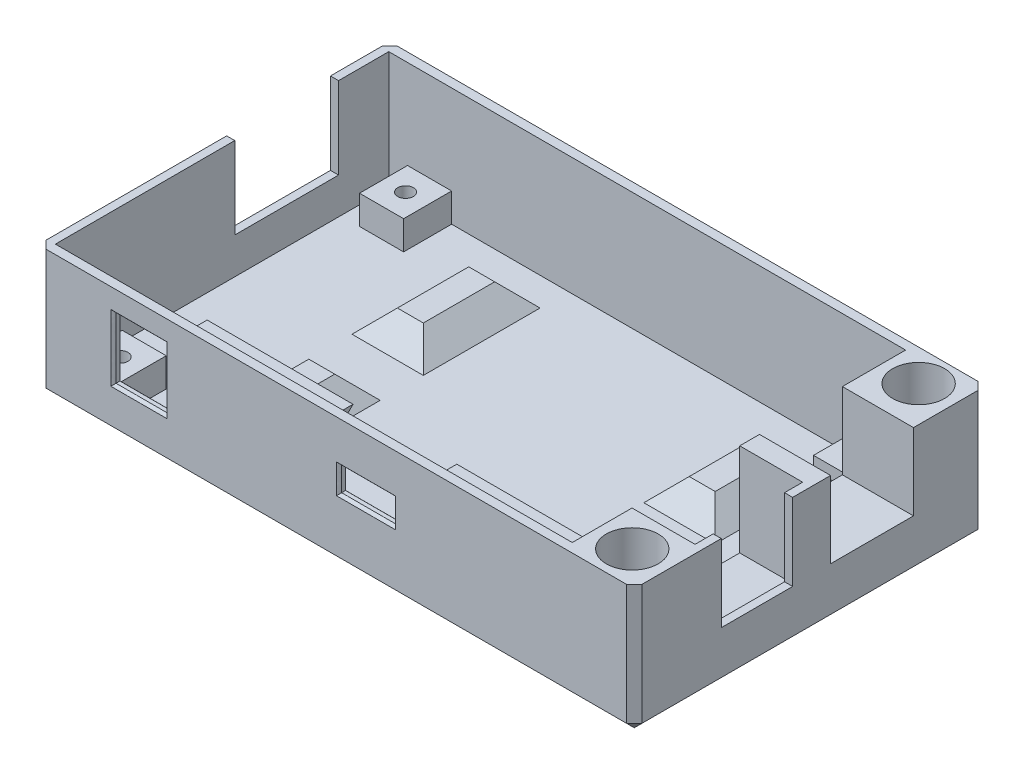
from build123d import *

# Parameters (mm, degrees)
SKETCH1_W                                  = 116.713
SKETCH1_H                                  = 68.834
BOSS_EXTRUDE1_DEPTH                        = 25.0952
SKETCH2_W                                  = 101.2063
SKETCH2_H                                  = 65.278
HOLLOW_DEPTH                               = 23.110825
F_5V_HOLE_REACH                            = 126.523
SKETCH3_W                                  = 10.016
SKETCH3_H                                  = 12.016
USB_HOLE_REACH                             = 125.549
SKETCH4_W                                  = 10.54
SKETCH4_H                                  = 4.72
SKETCH11_W                                 = 8.636
SKETCH11_H                                 = 9.398
PCB_MOUNT_BOSS_DEPTH                       = 7.62
SKETCH8_R                                  = 5.08
HOLE_TO_ACCEPT_TOP_DEPTH                   = 18.7452
SKETCH9_R                                  = 1.5875
SKETCH9_R_2                                = 1.524
HOLE_SCREWS_DEPTH                          = 125.379362571
SKETCH12_R                                 = 1.524
SCREW_FASTENER_HOLES_DEPTH                 = 6.604
SKETCH10_R                                 = 2.8194
PAN_HEAD_COUNTER_SINK_DEPTH                = 2.286
SKETCH13_W                                 = 6.35
SKETCH13_H                                 = 3.175
NUT_SLOT_1_DEPTH                           = 7.62
NUT_START                                  = 46.482
SKETCH13_3_W                               = 6.35
SKETCH13_3_H                               = 3.175
NUT_SLOT_2_DEPTH                           = 7.62
HEX_OUT_NUT_SLOT_DEPTH                     = 3.175
SKETCH24_W                                 = 12.3317
SKETCH24_H                                 = 21.082
F_4_PIN_1_DEPTH                            = 18.161
F_4_PIN_2_REACH                            = 137.297
SKETCH25_W                                 = 13.97
SKETCH25_H                                 = 11.176
CUT_EXTRUDE6_REACH                         = 137.297
SKETCH26_W                                 = 13.97
SKETCH26_H                                 = 3.937
SKETCH5_W                                  = 16.2306
SKETCH5_H                                  = 16.2306
F_9_PIN_IN_DEPTH                           = 124.490970611
SKETCH23_W                                 = 20.32
SKETCH23_H                                 = 18.415
F_9_PIN_OUT_DEPTH                          = 1.5875
FILLET2_START                              = 4.1020999
FILLET2_DEPTH                              = 5.7360002
FILLET2_START_2                            = 0.5714999
FILLET2_2_DEPTH                            = 13.0320002
FILLET2_START_3                            = -77.0339999
FILLET2_3_DEPTH                            = 46.0339999
FILLET2_START_4                            = -89
FILLET2_4_DEPTH                            = 45.1127999
KEY_HOLE_1_DEPTH                           = 124.994221651
SKETCH17_W                                 = 13.97
SKETCH17_H                                 = 22.86
COVER_MOUNTING_SCREW_HEADS_DEPTH           = 4.445
COVER_MOUNTING_SCREW_HEADS_DRAFT           = 45
COVER_MOUNTING_SCREW_HEADS_PROFILE_2_DEPTH = 4.445
COVER_MOUNTING_SCREW_HEADS_PROFILE_2_DRAFT = 45
SKETCH18_W                                 = 10.795
SKETCH18_H                                 = 19.685
HOLLOW_FOR_SCREWS_DEPTH                    = 3.556
HOLLOW_FOR_SCREWS_DRAFT                    = 45
HOLLOW_FOR_SCREWS_PROFILE_2_DEPTH          = 3.556
HOLLOW_FOR_SCREWS_PROFILE_2_DRAFT          = 45
KEYHOLE_MIRROR_COPY_1_SKETCH_W             = 13.97
KEYHOLE_MIRROR_COPY_1_SKETCH_H             = 22.86
KEYHOLE_MIRROR_COPY_1_DEPTH                = 4.445
KEYHOLE_MIRROR_COPY_1_DRAFT                = 45
KEYHOLE_MIRROR_COPY_2_SKETCH_W             = 13.97
KEYHOLE_MIRROR_COPY_2_SKETCH_H             = 22.86
KEYHOLE_MIRROR_COPY_2_DEPTH                = 4.445
KEYHOLE_MIRROR_COPY_2_DRAFT                = 45
KEYHOLE_MIRROR_COPY_3_SKETCH_W             = 13.97
KEYHOLE_MIRROR_COPY_3_SKETCH_H             = 22.86
KEYHOLE_MIRROR_COPY_3_DEPTH                = 4.445
KEYHOLE_MIRROR_COPY_3_DRAFT                = 45
KEYHOLE_MIRROR_COPY_4_SKETCH_W             = 10.795
KEYHOLE_MIRROR_COPY_4_SKETCH_H             = 19.685
KEYHOLE_MIRROR_COPY_4_DEPTH                = 3.556
KEYHOLE_MIRROR_COPY_4_DRAFT                = 45
KEYHOLE_MIRROR_COPY_5_SKETCH_W             = 10.795
KEYHOLE_MIRROR_COPY_5_SKETCH_H             = 19.685
KEYHOLE_MIRROR_COPY_5_DEPTH                = 3.556
KEYHOLE_MIRROR_COPY_5_DRAFT                = 45
KEYHOLE_MIRROR_COPY_6_SKETCH_W             = 10.795
KEYHOLE_MIRROR_COPY_6_SKETCH_H             = 19.685
KEYHOLE_MIRROR_COPY_6_DEPTH                = 3.556
KEYHOLE_MIRROR_COPY_6_DRAFT                = 45
CHAMFER1_SIZE                              = 1.524
LCD_BACKSTOP_1_DEPTH                       = 27.1272
LCD_START                                  = 47.4472
LCD_BACKSTOP_2_DEPTH                       = 28.5708
SKETCH29_R                                 = 0.9921875
ANTENNA_DEPTH                              = 123.853065822


with BuildPart() as part:
    # Sketch1 → Boss-Extrude1 (new body)
    with BuildSketch(Plane(origin=(0, -7.62, 0), x_dir=(1, 0, 0), z_dir=(0, 1, 0))):
        with Locations((-43.9293, 31.75)):
            Rectangle(SKETCH1_W, SKETCH1_H)
    extrude(amount=BOSS_EXTRUDE1_DEPTH)

    # Sketch2 → hollow (cut)
    with BuildSketch(Plane(origin=(0, 17.4752, 0), x_dir=(1, 0, 0), z_dir=(0, 1, 0))):
        with Locations((-50.09515, 31.75)):
            Rectangle(SKETCH2_W, SKETCH2_H)
    extrude(amount=-HOLLOW_DEPTH, mode=Mode.SUBTRACT)

    # Sketch3 → 5v hole (cut, up to next)
    with BuildSketch(Plane.XY.offset(2.667), mode=Mode.PRIVATE) as f_5v_hole_sk1:
        with Locations((-82.55, 7.0875)):
            Rectangle(SKETCH3_W, SKETCH3_H)
    f_5v_hole_tool1 = extrude(f_5v_hole_sk1.sketch, amount=-F_5V_HOLE_REACH, mode=Mode.PRIVATE) & part.part
    add(f_5v_hole_tool1.solids().sort_by_distance((-82.55, 7.0875, 2.667))[0], mode=Mode.SUBTRACT)

    # Sketch4 → USB hole (cut, up to next)
    with BuildSketch(Plane(origin=(0, 0, 0.889), x_dir=(-1, 0, 0), z_dir=(0, 0, -1)), mode=Mode.PRIVATE) as usb_hole_sk1:
        with Locations((38.1092, 6.9701)):
            Rectangle(SKETCH4_W, SKETCH4_H)
    usb_hole_tool1 = extrude(usb_hole_sk1.sketch, amount=-USB_HOLE_REACH, mode=Mode.PRIVATE) & part.part
    add(usb_hole_tool1.solids().sort_by_distance((-38.1092, 6.9701, 0.889))[0], mode=Mode.SUBTRACT)

    # Sketch11 → PCB mount boss (add)
    with BuildSketch(Plane(origin=(0, -7.62, 0), x_dir=(1, 0, 0), z_dir=(0, 1, 0))):
        with Locations((-92.71, 3.81)):
            Rectangle(SKETCH11_W, SKETCH11_H)
        with Locations((-92.71, 59.69)):
            Rectangle(SKETCH11_W, SKETCH11_H)
        with Locations((-3.81, 59.69)):
            Rectangle(SKETCH11_W, SKETCH11_H)
        with Locations((-3.81, 3.81)):
            Rectangle(SKETCH11_W, SKETCH11_H)
    extrude(amount=PCB_MOUNT_BOSS_DEPTH)

    # Sketch8 → hole to accept top (cut)
    with BuildSketch(Plane(origin=(0, 17.4752, 0), x_dir=(1, 0, 0), z_dir=(0, 1, 0))):
        with Locations(Location((7.4676, 3.8989, 0), (0, 0, 270))):
            Circle(SKETCH8_R)
        with Locations(Location((7.4676, 59.9821, 0), (0, 0, 270))):
            Circle(SKETCH8_R)
    extrude(amount=-HOLE_TO_ACCEPT_TOP_DEPTH, mode=Mode.SUBTRACT)

    # Sketch9 → hole screws (cut, through all)
    with BuildSketch(Plane.XZ.offset(7.62)):
        with Locations(Location((7.4676, -59.9821, 0), (0, 0, 270))):
            Circle(SKETCH9_R)
        with Locations(Location((7.4676, -3.8989, 0), (0, 0, 270))):
            Circle(SKETCH9_R)
        with Locations(Location((-92.71, -59.69, 0), (0, 0, 270))):
            Circle(SKETCH9_R_2)
        with Locations(Location((-92.71, -3.81, 0), (0, 0, 270))):
            Circle(SKETCH9_R_2)
    extrude(amount=-HOLE_SCREWS_DEPTH, mode=Mode.SUBTRACT)

    # Sketch12 → screw fastener holes (cut)
    with BuildSketch(Plane(origin=(0, 0, 0), x_dir=(1, 0, 0), z_dir=(0, 1, 0))):
        with Locations(Location((-3.81, 3.81, 0), (0, 0, 270))):
            Circle(SKETCH12_R)
        with Locations(Location((-3.81, 59.69, 0), (0, 0, 270))):
            Circle(SKETCH12_R)
    extrude(amount=-SCREW_FASTENER_HOLES_DEPTH, mode=Mode.SUBTRACT)

    # Sketch10 → pan head counter sink (cut)
    with BuildSketch(Plane.XZ.offset(7.62)):
        with Locations(Location((7.4676, -59.9821, 0), (0, 0, 270))):
            Circle(SKETCH10_R)
        with Locations(Location((-92.71, -59.69, 0), (0, 0, 270))):
            Circle(SKETCH10_R)
        with Locations(Location((7.4676, -3.8989, 0), (0, 0, 270))):
            Circle(SKETCH10_R)
        with Locations(Location((-92.71, -3.81, 0), (0, 0, 270))):
            Circle(SKETCH10_R)
    extrude(amount=-PAN_HEAD_COUNTER_SINK_DEPTH, mode=Mode.SUBTRACT)

    # Sketch13 → nut slot 1 (cut)
    with BuildSketch(Plane(origin=(0, 0, -8.509), x_dir=(-1, 0, 0), z_dir=(0, 0, -1))):
        with Locations((3.81, -4.048125)):
            Rectangle(SKETCH13_W, SKETCH13_H)
    extrude(amount=-NUT_SLOT_1_DEPTH, mode=Mode.SUBTRACT)

    # Sketch13<3> → nut slot 2 (cut)
    with BuildSketch(Plane(origin=(0, 0, -8.509), x_dir=(-1, 0, 0), z_dir=(0, 0, -1)).offset(NUT_START)):
        with Locations((3.81, -4.048125)):
            Rectangle(SKETCH13_3_W, SKETCH13_3_H)
    extrude(amount=NUT_SLOT_2_DEPTH, mode=Mode.SUBTRACT)

    # Sketch15 → hex out nut slot (cut)
    with BuildSketch(Plane(origin=(0, -5.635625, 0), x_dir=(1, 0, 0), z_dir=(0, 1, 0))):
        Polygon((-3.81, 55.877178822), (-0.508, 57.783589411), (-0.508, 61.596410589), (-3.81, 63.502821178), (-7.112, 61.596410589), (-7.112, 57.783589411), align=None)
        Polygon((-7.112, 1.903589411), (-3.81, -0.002821178), (-0.508, 1.903589411), (-0.508, 5.716410589), (-3.81, 7.622821178), (-7.112, 5.716410589), align=None)
    extrude(amount=HEX_OUT_NUT_SLOT_DEPTH, mode=Mode.SUBTRACT)

    # Sketch24 → 4 pin 1 (cut)
    with BuildSketch(Plane(origin=(0, 17.4752, 0), x_dir=(1, 0, 0), z_dir=(0, 1, 0))):
        with Locations((6.67385, 21.3614)):
            Rectangle(SKETCH24_W, SKETCH24_H)
    extrude(amount=-F_4_PIN_1_DEPTH, mode=Mode.SUBTRACT)

    # Sketch25 → 4 pin 2 (cut, up to next)
    with BuildSketch(Plane(origin=(14.4272, 0, 0), x_dir=(0, 0, -1), z_dir=(1, 0, 0)), mode=Mode.PRIVATE) as f_4_pin_2_sk1:
        with Locations((21.3614, 7.9502)):
            Rectangle(SKETCH25_W, SKETCH25_H)
    f_4_pin_2_tool1 = extrude(f_4_pin_2_sk1.sketch, amount=-F_4_PIN_2_REACH, mode=Mode.PRIVATE) & part.part
    add(f_4_pin_2_tool1.solids().sort_by_distance((14.4272, 7.9502, -21.3614))[0], mode=Mode.SUBTRACT)

    # Sketch26 → Cut-Extrude6 (cut, up to next)
    with BuildSketch(Plane(origin=(14.4272, 0, 0), x_dir=(0, 0, -1), z_dir=(1, 0, 0)), mode=Mode.PRIVATE) as cut_extrude6_sk1:
        with Locations((21.3614, 15.5067)):
            Rectangle(SKETCH26_W, SKETCH26_H)
    cut_extrude6_tool1 = extrude(cut_extrude6_sk1.sketch, amount=-CUT_EXTRUDE6_REACH, mode=Mode.PRIVATE) & part.part
    add(cut_extrude6_tool1.solids().sort_by_distance((14.4272, 15.5067, -21.3614))[0], mode=Mode.SUBTRACT)

    # Sketch5 → 9 pin in (cut, through all)
    with BuildSketch(Plane.ZY.offset(-0.508)):
        with Locations((-43.8912, 10.6172)):
            Rectangle(SKETCH5_W, SKETCH5_H)
    extrude(amount=-F_9_PIN_IN_DEPTH, mode=Mode.SUBTRACT)

    # Sketch23 → 9 pin out (cut)
    with BuildSketch(Plane.ZY.offset(102.2858)):
        with Locations((-44.3992, 10.668)):
            Rectangle(SKETCH23_W, SKETCH23_H)
    extrude(amount=-F_9_PIN_OUT_DEPTH, mode=Mode.SUBTRACT)

    # Fillet2: read off the stored shape, not the designer's step
    # Fillet2 outline → Fillet2 (cut)
    with BuildSketch(Plane(origin=(0, 0, 0), x_dir=(1, 0, 0), z_dir=(0, 1, 0)).offset(FILLET2_START)):
        with BuildLine():
            Line((-32.8392, -0.889), (-32.8392, -1.397))
            add(Edge.make_bspline(
                [(-32.8392, -1.397), (-32.8392, -0.889), (-32.3312, -0.889)],
                knots=[0, 0, 0, 1, 1, 1], degree=2, weights=[1, 0.035921024, 1]))
            Line((-32.3312, -0.889), (-32.8392, -0.889))
        make_face()
        Polygon((-32.8392, -2.159), (-32.8392, -1.397), (-32.8392, -0.889), (-43.3792, -0.889), (-43.3792, -1.397), (-43.3792, -2.159), (-43.3792, -2.667), (-32.8392, -2.667), align=None)
        with BuildLine():
            add(Edge.make_bspline(
                [(-32.8392, -2.159), (-32.8392, -2.667), (-32.3312, -2.667)],
                knots=[0, 0, 0, 1, 1, 1], degree=2, weights=[1, 0.035921024, 1]))
            Line((-32.8392, -2.159), (-32.8392, -2.667))
            Line((-32.8392, -2.667), (-32.3312, -2.667))
        make_face()
        with BuildLine():
            Line((-43.3792, -1.397), (-43.3792, -0.889))
            Line((-43.3792, -0.889), (-43.8872, -0.889))
            add(Edge.make_bspline(
                [(-43.3792, -1.397), (-43.3792, -0.889), (-43.8872, -0.889)],
                knots=[0, 0, 0, 1, 1, 1], degree=2, weights=[1, 0.035921024, 1]))
        make_face()
        with BuildLine():
            Line((-43.8872, -2.667), (-43.3792, -2.667))
            Line((-43.3792, -2.667), (-43.3792, -2.159))
            add(Edge.make_bspline(
                [(-43.3792, -2.159), (-43.3792, -2.667), (-43.8872, -2.667)],
                knots=[0, 0, 0, 1, 1, 1], degree=2, weights=[1, 0.035921024, 1]))
        make_face()
        with BuildLine():
            add(Edge.make_bspline(
                [(-77.542, -1.397), (-77.542, -0.889), (-77.034, -0.889)],
                knots=[0, 0, 0, 1, 1, 1], degree=2, weights=[1, 0.035921024, 1]))
            Line((-77.034, -0.889), (-77.542, -0.889))
            Line((-77.542, -0.889), (-77.542, -1.397))
        make_face()
        with BuildLine():
            Line((-77.542, -2.667), (-77.034, -2.667))
            add(Edge.make_bspline(
                [(-77.542, -2.159), (-77.542, -2.667), (-77.034, -2.667)],
                knots=[0, 0, 0, 1, 1, 1], degree=2, weights=[1, 0.035921024, 1]))
            Line((-77.542, -2.159), (-77.542, -2.667))
        make_face()
        with BuildLine():
            Line((-87.558, -1.397), (-87.558, -0.889))
            Line((-87.558, -0.889), (-88.066, -0.889))
            add(Edge.make_bspline(
                [(-87.558, -1.397), (-87.558, -0.889), (-88.066, -0.889)],
                knots=[0, 0, 0, 1, 1, 1], degree=2, weights=[1, 0.035921024, 1]))
        make_face()
        with BuildLine():
            Line((-88.066, -2.667), (-87.558, -2.667))
            Line((-87.558, -2.667), (-87.558, -2.159))
            add(Edge.make_bspline(
                [(-87.558, -2.159), (-87.558, -2.667), (-88.066, -2.667)],
                knots=[0, 0, 0, 1, 1, 1], degree=2, weights=[1, 0.035921024, 1]))
        make_face()
    extrude(amount=FILLET2_DEPTH, mode=Mode.SUBTRACT)

    # Fillet2 2 outline → Fillet2 2 (cut)
    with BuildSketch(Plane(origin=(0, 0, 0), x_dir=(1, 0, 0), z_dir=(0, 1, 0)).offset(FILLET2_START_2)):
        with BuildLine():
            add(Edge.make_bspline(
                [(-77.542, -1.397), (-77.542, -0.889), (-77.034, -0.889)],
                knots=[0, 0, 0, 1, 1, 1], degree=2, weights=[1, 0.035921024, 1]))
            Line((-77.034, -0.889), (-77.542, -0.889))
            Line((-77.542, -0.889), (-77.542, -1.397))
        make_face()
        with BuildLine():
            Line((-77.542, -2.667), (-77.034, -2.667))
            add(Edge.make_bspline(
                [(-77.542, -2.159), (-77.542, -2.667), (-77.034, -2.667)],
                knots=[0, 0, 0, 1, 1, 1], degree=2, weights=[1, 0.035921024, 1]))
            Line((-77.542, -2.159), (-77.542, -2.667))
        make_face()
        Polygon((-77.542, -2.159), (-77.542, -1.397), (-77.542, -0.889), (-87.558, -0.889), (-87.558, -1.397), (-87.558, -2.159), (-87.558, -2.667), (-77.542, -2.667), align=None)
        with BuildLine():
            Line((-87.558, -1.397), (-87.558, -0.889))
            Line((-87.558, -0.889), (-88.066, -0.889))
            add(Edge.make_bspline(
                [(-87.558, -1.397), (-87.558, -0.889), (-88.066, -0.889)],
                knots=[0, 0, 0, 1, 1, 1], degree=2, weights=[1, 0.035921024, 1]))
        make_face()
        with BuildLine():
            Line((-88.066, -2.667), (-87.558, -2.667))
            Line((-87.558, -2.667), (-87.558, -2.159))
            add(Edge.make_bspline(
                [(-87.558, -2.159), (-87.558, -2.667), (-88.066, -2.667)],
                knots=[0, 0, 0, 1, 1, 1], degree=2, weights=[1, 0.035921024, 1]))
        make_face()
    extrude(amount=FILLET2_2_DEPTH, mode=Mode.SUBTRACT)

    # Fillet2 3 outline → Fillet2 3 (add)
    with BuildSketch(Plane.YZ.offset(FILLET2_START_3)):
        with BuildLine():
            add(Edge.make_bspline(
                [(4.6101, 1.397), (4.6101, 0.889), (4.1021, 0.889)],
                knots=[0, 0, 0, 1, 1, 1], degree=2, weights=[1, 0.035921024, 1]))
            Line((4.6101, 1.397), (4.6101, 2.159))
            add(Edge.make_bspline(
                [(4.6101, 2.159), (4.6101, 2.667), (4.1021, 2.667)],
                knots=[0, 0, 0, 1, 1, 1], degree=2, weights=[1, 0.035921024, 1]))
            Line((4.1021, 2.667), (4.1021, 0.889))
        make_face()
        with BuildLine():
            Line((9.3301, 2.159), (9.3301, 1.397))
            add(Edge.make_bspline(
                [(9.3301, 1.397), (9.3301, 0.889), (9.8381, 0.889)],
                knots=[0, 0, 0, 1, 1, 1], degree=2, weights=[1, 0.035921024, 1]))
            Line((9.8381, 0.889), (9.8381, 2.667))
            add(Edge.make_bspline(
                [(9.3301, 2.159), (9.3301, 2.667), (9.8381, 2.667)],
                knots=[0, 0, 0, 1, 1, 1], degree=2, weights=[1, 0.035921024, 1]))
        make_face()
    extrude(amount=FILLET2_3_DEPTH)

    # Fillet2 4 outline → Fillet2 4 (add)
    with BuildSketch(Plane.YZ.offset(FILLET2_START_4)):
        with BuildLine():
            add(Edge.make_bspline(
                [(1.0795, 1.397), (1.0795, 0.889), (0.5715, 0.889)],
                knots=[0, 0, 0, 1, 1, 1], degree=2, weights=[1, 0.035921024, 1]))
            Line((1.0795, 1.397), (1.0795, 2.159))
            add(Edge.make_bspline(
                [(1.0795, 2.159), (1.0795, 2.667), (0.5715, 2.667)],
                knots=[0, 0, 0, 1, 1, 1], degree=2, weights=[1, 0.035921024, 1]))
            Line((0.5715, 2.667), (0.5715, 0.889))
        make_face()
        with BuildLine():
            Line((13.0955, 2.159), (13.0955, 1.397))
            add(Edge.make_bspline(
                [(13.0955, 1.397), (13.0955, 0.889), (13.6035, 0.889)],
                knots=[0, 0, 0, 1, 1, 1], degree=2, weights=[1, 0.035921024, 1]))
            Line((13.6035, 0.889), (13.6035, 2.667))
            add(Edge.make_bspline(
                [(13.0955, 2.159), (13.0955, 2.667), (13.6035, 2.667)],
                knots=[0, 0, 0, 1, 1, 1], degree=2, weights=[1, 0.035921024, 1]))
        make_face()
    extrude(amount=FILLET2_4_DEPTH)

    # Sketch16 → key hole 1 (cut, through all)
    with BuildSketch(Plane(origin=(0, -5.635625, 0), x_dir=(1, 0, 0), z_dir=(0, 1, 0))):
        with BuildLine():
            Line((-74.33818, 54.229), (-74.33818, 48.744399721))
            ThreePointArc((-74.33818, 48.744399721), (-72.5043, 42.418), (-70.67042, 48.744399721))
            Line((-70.67042, 48.744399721), (-70.67042, 54.229))
            ThreePointArc((-70.67042, 54.229), (-72.5043, 56.06288), (-74.33818, 54.229))
        make_face()
        with BuildLine():
            Line((-17.18818, 54.229), (-17.18818, 48.744399721))
            ThreePointArc((-17.18818, 48.744399721), (-15.3543, 42.418), (-13.52042, 48.744399721))
            Line((-13.52042, 48.744399721), (-13.52042, 54.229))
            ThreePointArc((-13.52042, 54.229), (-15.3543, 56.06288), (-17.18818, 54.229))
        make_face()
    key_hole_1 = extrude(amount=-KEY_HOLE_1_DEPTH, mode=Mode.SUBTRACT)


with BuildPart() as cover_mounting_screw_heads_tool:
    # Sketch17 → cover mounting screw heads (with draft: the straight prism first)
    with BuildSketch(Plane(origin=(0, -5.635625, 0), x_dir=(1, 0, 0), z_dir=(0, 1, 0))):
        with Locations((-72.5043, 47.40656)):
            Rectangle(SKETCH17_W, SKETCH17_H)
    extrude(amount=COVER_MOUNTING_SCREW_HEADS_DEPTH)
    # cover mounting screw heads: the draft: its side faces are tilted about the plane it starts from
    cover_mounting_screw_heads_sides = [cover_mounting_screw_heads_tool.faces().sort_by_distance(p)[0] for p in [
        (-79.4893, -3.413125, -47.40656),
        (-72.5043, -3.413125, -35.97656),
        (-65.5193, -3.413125, -47.40656),
        (-72.5043, -3.413125, -58.83656),
    ]]
    draft(cover_mounting_screw_heads_sides, Plane(origin=(0, -5.635625, 0), x_dir=(1, 0, 0), z_dir=(0, 1, 0)), COVER_MOUNTING_SCREW_HEADS_DRAFT)


with BuildPart() as part_1:
    add(part.part)

    # cover mounting screw heads: add cover_mounting_screw_heads_tool
    add(cover_mounting_screw_heads_tool.part)


with BuildPart() as cover_mounting_screw_heads_profile_2_tool:
    # Sketch17 → cover mounting screw heads profile 2 (with draft: the straight prism first)
    with BuildSketch(Plane(origin=(0, -5.635625, 0), x_dir=(1, 0, 0), z_dir=(0, 1, 0))):
        with Locations((-15.3543, 47.40656)):
            Rectangle(SKETCH17_W, SKETCH17_H)
    extrude(amount=COVER_MOUNTING_SCREW_HEADS_PROFILE_2_DEPTH)
    # cover mounting screw heads profile 2: the draft: its side faces are tilted about the plane it starts from
    cover_mounting_screw_heads_profile_2_sides = [cover_mounting_screw_heads_profile_2_tool.faces().sort_by_distance(p)[0] for p in [
        (-22.3393, -3.413125, -47.40656),
        (-15.3543, -3.413125, -35.97656),
        (-8.3693, -3.413125, -47.40656),
        (-15.3543, -3.413125, -58.83656),
    ]]
    draft(cover_mounting_screw_heads_profile_2_sides, Plane(origin=(0, -5.635625, 0), x_dir=(1, 0, 0), z_dir=(0, 1, 0)), COVER_MOUNTING_SCREW_HEADS_PROFILE_2_DRAFT)


with BuildPart() as part_2:
    add(part_1.part)

    # cover mounting screw heads profile 2: add cover_mounting_screw_heads_profile_2_tool
    add(cover_mounting_screw_heads_profile_2_tool.part)


with BuildPart() as hollow_for_screws_tool:
    # Sketch18 → hollow for screws (with draft: the straight prism first)
    with BuildSketch(Plane(origin=(0, -5.635625, 0), x_dir=(1, 0, 0), z_dir=(0, 1, 0))):
        with Locations((-72.5043, 47.40656)):
            Rectangle(SKETCH18_W, SKETCH18_H)
    extrude(amount=HOLLOW_FOR_SCREWS_DEPTH)
    # hollow for screws: the draft: its side faces are tilted about the plane it starts from
    hollow_for_screws_sides = [hollow_for_screws_tool.faces().sort_by_distance(p)[0] for p in [
        (-77.9018, -3.857625, -47.40656),
        (-72.5043, -3.857625, -37.56406),
        (-67.1068, -3.857625, -47.40656),
        (-72.5043, -3.857625, -57.24906),
    ]]
    draft(hollow_for_screws_sides, Plane(origin=(0, -5.635625, 0), x_dir=(1, 0, 0), z_dir=(0, 1, 0)), HOLLOW_FOR_SCREWS_DRAFT)


with BuildPart() as part_3:
    add(part_2.part)

    # hollow for screws: cut by hollow_for_screws_tool
    add(hollow_for_screws_tool.part, mode=Mode.SUBTRACT)


with BuildPart() as hollow_for_screws_profile_2_tool:
    # Sketch18 → hollow for screws profile 2 (with draft: the straight prism first)
    with BuildSketch(Plane(origin=(0, -5.635625, 0), x_dir=(1, 0, 0), z_dir=(0, 1, 0))):
        with Locations((-15.3543, 47.40656)):
            Rectangle(SKETCH18_W, SKETCH18_H)
    extrude(amount=HOLLOW_FOR_SCREWS_PROFILE_2_DEPTH)
    # hollow for screws profile 2: the draft: its side faces are tilted about the plane it starts from
    hollow_for_screws_profile_2_sides = [hollow_for_screws_profile_2_tool.faces().sort_by_distance(p)[0] for p in [
        (-15.3543, -3.857625, -37.56406),
        (-9.9568, -3.857625, -47.40656),
        (-15.3543, -3.857625, -57.24906),
        (-20.7518, -3.857625, -47.40656),
    ]]
    draft(hollow_for_screws_profile_2_sides, Plane(origin=(0, -5.635625, 0), x_dir=(1, 0, 0), z_dir=(0, 1, 0)), HOLLOW_FOR_SCREWS_PROFILE_2_DRAFT)


with BuildPart() as part_4:
    add(part_3.part)

    # hollow for screws profile 2: cut by hollow_for_screws_profile_2_tool
    add(hollow_for_screws_profile_2_tool.part, mode=Mode.SUBTRACT)

    # keyhole mirror: key hole 1 across plane
    add(key_hole_1.mirror(Plane(origin=(0, 0, -31.75), x_dir=(1, 0, 0), z_dir=(0, 0, -1))), mode=Mode.SUBTRACT)


with BuildPart() as keyhole_mirror_copy_1_tool:
    # keyhole mirror copy 1 sketch → keyhole mirror copy 1 (with draft: the straight prism first)
    with BuildSketch(Plane(origin=(0, -5.635625, -63.5), x_dir=(1, 0, 0), z_dir=(0, 1, 0))):
        with Locations((-72.5043, -47.40656)):
            Rectangle(KEYHOLE_MIRROR_COPY_1_SKETCH_W, KEYHOLE_MIRROR_COPY_1_SKETCH_H)
    extrude(amount=KEYHOLE_MIRROR_COPY_1_DEPTH)
    # keyhole mirror copy 1: the draft: its side faces are tilted about the plane it starts from
    keyhole_mirror_copy_1_sides = [keyhole_mirror_copy_1_tool.faces().sort_by_distance(p)[0] for p in [
        (-79.4893, -3.413125, -16.09344),
        (-72.5043, -3.413125, -27.52344),
        (-65.5193, -3.413125, -16.09344),
        (-72.5043, -3.413125, -4.66344),
    ]]
    draft(keyhole_mirror_copy_1_sides, Plane(origin=(0, -5.635625, -63.5), x_dir=(1, 0, 0), z_dir=(0, 1, 0)), KEYHOLE_MIRROR_COPY_1_DRAFT)


with BuildPart() as part_5:
    add(part_4.part)

    # keyhole mirror copy 1: add keyhole_mirror_copy_1_tool
    add(keyhole_mirror_copy_1_tool.part)


with BuildPart() as keyhole_mirror_copy_2_tool:
    # keyhole mirror copy 2 sketch → keyhole mirror copy 2 (with draft: the straight prism first)
    with BuildSketch(Plane(origin=(0, -5.635625, -63.5), x_dir=(1, 0, 0), z_dir=(0, 1, 0))):
        with Locations((-15.3543, -47.40656)):
            Rectangle(KEYHOLE_MIRROR_COPY_2_SKETCH_W, KEYHOLE_MIRROR_COPY_2_SKETCH_H)
    extrude(amount=KEYHOLE_MIRROR_COPY_2_DEPTH)
    # keyhole mirror copy 2: the draft: its side faces are tilted about the plane it starts from
    keyhole_mirror_copy_2_sides = [keyhole_mirror_copy_2_tool.faces().sort_by_distance(p)[0] for p in [
        (-22.3393, -3.413125, -16.09344),
        (-15.3543, -3.413125, -27.52344),
        (-8.3693, -3.413125, -16.09344),
        (-15.3543, -3.413125, -4.66344),
    ]]
    draft(keyhole_mirror_copy_2_sides, Plane(origin=(0, -5.635625, -63.5), x_dir=(1, 0, 0), z_dir=(0, 1, 0)), KEYHOLE_MIRROR_COPY_2_DRAFT)


with BuildPart() as part_6:
    add(part_5.part)

    # keyhole mirror copy 2: add keyhole_mirror_copy_2_tool
    add(keyhole_mirror_copy_2_tool.part)


with BuildPart() as keyhole_mirror_copy_3_tool:
    # keyhole mirror copy 3 sketch → keyhole mirror copy 3 (with draft: the straight prism first)
    with BuildSketch(Plane(origin=(0, -5.635625, -63.5), x_dir=(1, 0, 0), z_dir=(0, 1, 0))):
        with Locations((-15.3543, -47.40656)):
            Rectangle(KEYHOLE_MIRROR_COPY_3_SKETCH_W, KEYHOLE_MIRROR_COPY_3_SKETCH_H)
    extrude(amount=KEYHOLE_MIRROR_COPY_3_DEPTH)
    # keyhole mirror copy 3: the draft: its side faces are tilted about the plane it starts from
    keyhole_mirror_copy_3_sides = [keyhole_mirror_copy_3_tool.faces().sort_by_distance(p)[0] for p in [
        (-22.3393, -3.413125, -16.09344),
        (-15.3543, -3.413125, -27.52344),
        (-8.3693, -3.413125, -16.09344),
        (-15.3543, -3.413125, -4.66344),
    ]]
    draft(keyhole_mirror_copy_3_sides, Plane(origin=(0, -5.635625, -63.5), x_dir=(1, 0, 0), z_dir=(0, 1, 0)), KEYHOLE_MIRROR_COPY_3_DRAFT)


with BuildPart() as part_7:
    add(part_6.part)

    # keyhole mirror copy 3: add keyhole_mirror_copy_3_tool
    add(keyhole_mirror_copy_3_tool.part)


with BuildPart() as keyhole_mirror_copy_4_tool:
    # keyhole mirror copy 4 sketch → keyhole mirror copy 4 (with draft: the straight prism first)
    with BuildSketch(Plane(origin=(0, -5.635625, -63.5), x_dir=(1, 0, 0), z_dir=(0, 1, 0))):
        with Locations((-72.5043, -47.40656)):
            Rectangle(KEYHOLE_MIRROR_COPY_4_SKETCH_W, KEYHOLE_MIRROR_COPY_4_SKETCH_H)
    extrude(amount=KEYHOLE_MIRROR_COPY_4_DEPTH)
    # keyhole mirror copy 4: the draft: its side faces are tilted about the plane it starts from
    keyhole_mirror_copy_4_sides = [keyhole_mirror_copy_4_tool.faces().sort_by_distance(p)[0] for p in [
        (-77.9018, -3.857625, -16.09344),
        (-72.5043, -3.857625, -25.93594),
        (-67.1068, -3.857625, -16.09344),
        (-72.5043, -3.857625, -6.25094),
    ]]
    draft(keyhole_mirror_copy_4_sides, Plane(origin=(0, -5.635625, -63.5), x_dir=(1, 0, 0), z_dir=(0, 1, 0)), KEYHOLE_MIRROR_COPY_4_DRAFT)


with BuildPart() as part_8:
    add(part_7.part)

    # keyhole mirror copy 4: cut by keyhole_mirror_copy_4_tool
    add(keyhole_mirror_copy_4_tool.part, mode=Mode.SUBTRACT)


with BuildPart() as keyhole_mirror_copy_5_tool:
    # keyhole mirror copy 5 sketch → keyhole mirror copy 5 (with draft: the straight prism first)
    with BuildSketch(Plane(origin=(0, -5.635625, -63.5), x_dir=(1, 0, 0), z_dir=(0, 1, 0))):
        with Locations((-15.3543, -47.40656)):
            Rectangle(KEYHOLE_MIRROR_COPY_5_SKETCH_W, KEYHOLE_MIRROR_COPY_5_SKETCH_H)
    extrude(amount=KEYHOLE_MIRROR_COPY_5_DEPTH)
    # keyhole mirror copy 5: the draft: its side faces are tilted about the plane it starts from
    keyhole_mirror_copy_5_sides = [keyhole_mirror_copy_5_tool.faces().sort_by_distance(p)[0] for p in [
        (-15.3543, -3.857625, -25.93594),
        (-9.9568, -3.857625, -16.09344),
        (-15.3543, -3.857625, -6.25094),
        (-20.7518, -3.857625, -16.09344),
    ]]
    draft(keyhole_mirror_copy_5_sides, Plane(origin=(0, -5.635625, -63.5), x_dir=(1, 0, 0), z_dir=(0, 1, 0)), KEYHOLE_MIRROR_COPY_5_DRAFT)


with BuildPart() as part_9:
    add(part_8.part)

    # keyhole mirror copy 5: cut by keyhole_mirror_copy_5_tool
    add(keyhole_mirror_copy_5_tool.part, mode=Mode.SUBTRACT)


with BuildPart() as keyhole_mirror_copy_6_tool:
    # keyhole mirror copy 6 sketch → keyhole mirror copy 6 (with draft: the straight prism first)
    with BuildSketch(Plane(origin=(0, -5.635625, -63.5), x_dir=(1, 0, 0), z_dir=(0, 1, 0))):
        with Locations((-15.3543, -47.40656)):
            Rectangle(KEYHOLE_MIRROR_COPY_6_SKETCH_W, KEYHOLE_MIRROR_COPY_6_SKETCH_H)
    extrude(amount=KEYHOLE_MIRROR_COPY_6_DEPTH)
    # keyhole mirror copy 6: the draft: its side faces are tilted about the plane it starts from
    keyhole_mirror_copy_6_sides = [keyhole_mirror_copy_6_tool.faces().sort_by_distance(p)[0] for p in [
        (-15.3543, -3.857625, -25.93594),
        (-9.9568, -3.857625, -16.09344),
        (-15.3543, -3.857625, -6.25094),
        (-20.7518, -3.857625, -16.09344),
    ]]
    draft(keyhole_mirror_copy_6_sides, Plane(origin=(0, -5.635625, -63.5), x_dir=(1, 0, 0), z_dir=(0, 1, 0)), KEYHOLE_MIRROR_COPY_6_DRAFT)


with BuildPart() as part_10:
    add(part_9.part)

    # keyhole mirror copy 6: cut by keyhole_mirror_copy_6_tool
    add(keyhole_mirror_copy_6_tool.part, mode=Mode.SUBTRACT)

    # Chamfer1
    chamfer1_edges = [part_10.edges().sort_by_distance(p)[0] for p in [
        (-102.2858, 4.9276, 2.667),
        (-43.9293, -7.62, 2.667),
        (14.4272, 4.9276, 2.667),
        (14.4272, -7.62, -31.75),
        (14.4272, 4.9276, -66.167),
        (-43.9293, -7.62, -66.167),
        (-102.2858, 4.9276, -66.167),
        (-102.2858, -7.62, -31.75),
    ]]
    chamfer(chamfer1_edges, length=CHAMFER1_SIZE)

    # Sketch28 → lcd backstop 1 (add)
    with BuildSketch(Plane.ZY.offset(-0.508)):
        Polygon((0.889, 10.414), (0.889, 14.9352), (-3.6322, 14.9352), align=None)
    extrude(amount=LCD_BACKSTOP_1_DEPTH)

    # Sketch28<2> → lcd backstop 2 (add)
    with BuildSketch(Plane.ZY.offset(-0.508).offset(LCD_START)):
        Polygon((-3.6322, 14.9352), (0.889, 10.414), (0.889, 14.9352), align=None)
    extrude(amount=LCD_BACKSTOP_2_DEPTH)

    # Sketch29 → antenna (cut, through all)
    with BuildSketch(Plane(origin=(0, 1.5875, 0), x_dir=(1, 0, 0), z_dir=(0, 1, 0))):
        with Locations(Location((-68.58, 5.08, 0), (0, 0, 270))):
            Circle(SKETCH29_R)
    extrude(amount=-ANTENNA_DEPTH, mode=Mode.SUBTRACT)


solid = part_10.part
